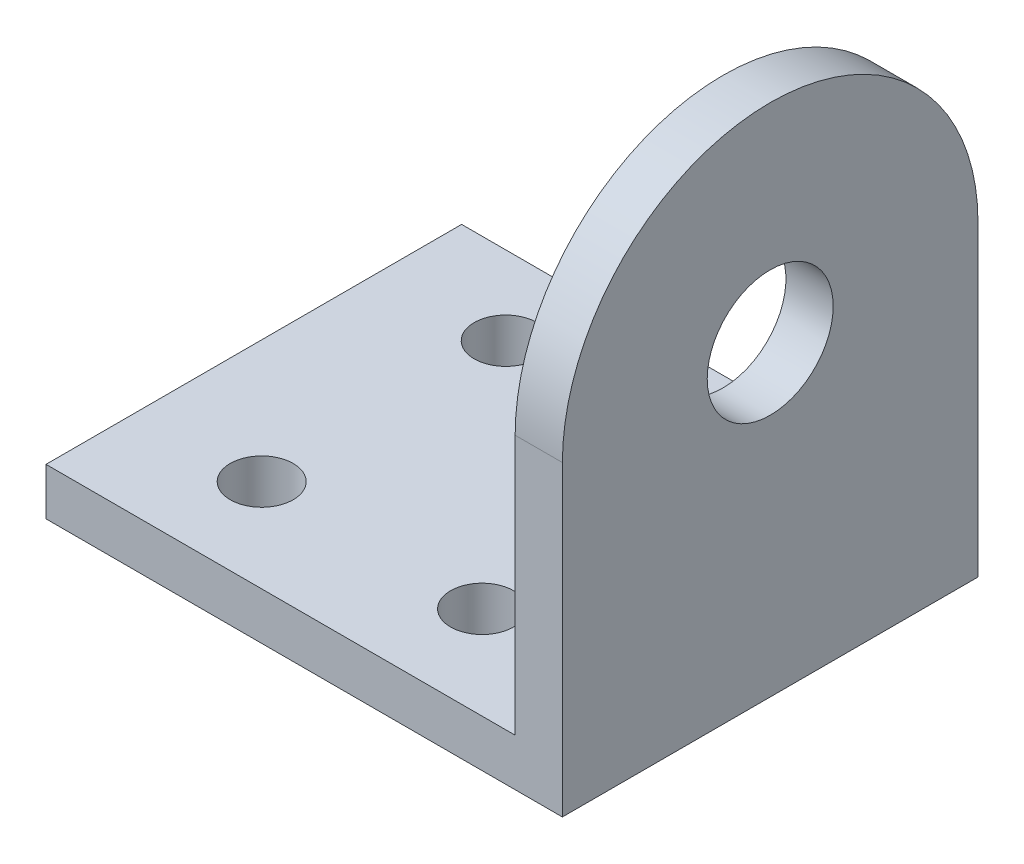
from build123d import *

# Parameters (mm, degrees)
BOSS_EXTRUDE1_OUTLINE_W = 3
BOSS_EXTRUDE1_OUTLINE_H = 26.4
BOSS_EXTRUDE1_DEPTH     = 32.7
SKETCH2_W               = 26.4
SKETCH2_H               = 3
BOSS_EXTRUDE2_DEPTH     = 29.8
SKETCH3_R               = 2
CUT_EXTRUDE1_DEPTH      = 3
CUT_EXTRUDE3_DEPTH      = 12
SKETCH6_R               = 4
CUT_EXTRUDE4_DEPTH      = 12


# Read off the part's stored shape, not the designer's step: Boss-Extrude1
with BuildPart() as part:
    # Boss-Extrude1 outline → Boss-Extrude1 (new body)
    with BuildSketch(Plane(origin=(0, 0, 0), x_dir=(1, 0, 0), z_dir=(0, 1, 0))):
        with Locations((-1.5, -0.285443038)):
            Rectangle(BOSS_EXTRUDE1_OUTLINE_W, BOSS_EXTRUDE1_OUTLINE_H)
    extrude(amount=BOSS_EXTRUDE1_DEPTH)

    # Sketch2 → Boss-Extrude2 (add)
    with BuildSketch(Plane.ZY.offset(3)):
        with Locations((0.285443038, 1.5)):
            Rectangle(SKETCH2_W, SKETCH2_H)
    extrude(amount=BOSS_EXTRUDE2_DEPTH)

    # Sketch3 → Cut-Extrude1 (cut)
    with BuildSketch(Plane(origin=(0, 3, 0), x_dir=(1, 0, 0), z_dir=(0, 1, 0))):
        with Locations(Location((-25, 7.914556962, 0), (0, 0, 270))):
            Circle(SKETCH3_R)
        with Locations(Location((-11, 7.914556962, 0), (0, 0, 270))):
            Circle(SKETCH3_R)
        with Locations(Location((-11, -7.585443038, 0), (0, 0, 90))):
            Circle(SKETCH3_R)
        with Locations(Location((-25, -7.585443038, 0), (0, 0, 90))):
            Circle(SKETCH3_R)
    extrude(amount=-CUT_EXTRUDE1_DEPTH, mode=Mode.SUBTRACT)

    # Sketch5 → Cut-Extrude3 (cut)
    with BuildSketch(Plane.ZY.offset(3)):
        with BuildLine():
            Line((0.285443053, 32.7), (-12.914556962, 32.7))
            Line((-12.914556962, 32.7), (-12.914556962, 19.5))
            ThreePointArc((-12.914556962, 19.5), (-9.048366468, 28.833809517), (0.285443053, 32.7))
        make_face()
        with BuildLine():
            Line((13.485443038, 32.7), (0.285443053, 32.7))
            ThreePointArc((0.285443053, 32.7), (9.619252555, 28.833809506), (13.485443038, 19.5))
            Line((13.485443038, 19.5), (13.485443038, 32.7))
        make_face()
    extrude(amount=-CUT_EXTRUDE3_DEPTH, mode=Mode.SUBTRACT)

    # Sketch6 → Cut-Extrude4 (cut)
    with BuildSketch(Plane.ZY.offset(3)):
        with Locations((0.285443038, 19.5)):
            Circle(SKETCH6_R)
    extrude(amount=-CUT_EXTRUDE4_DEPTH, mode=Mode.SUBTRACT)


solid = part.part
